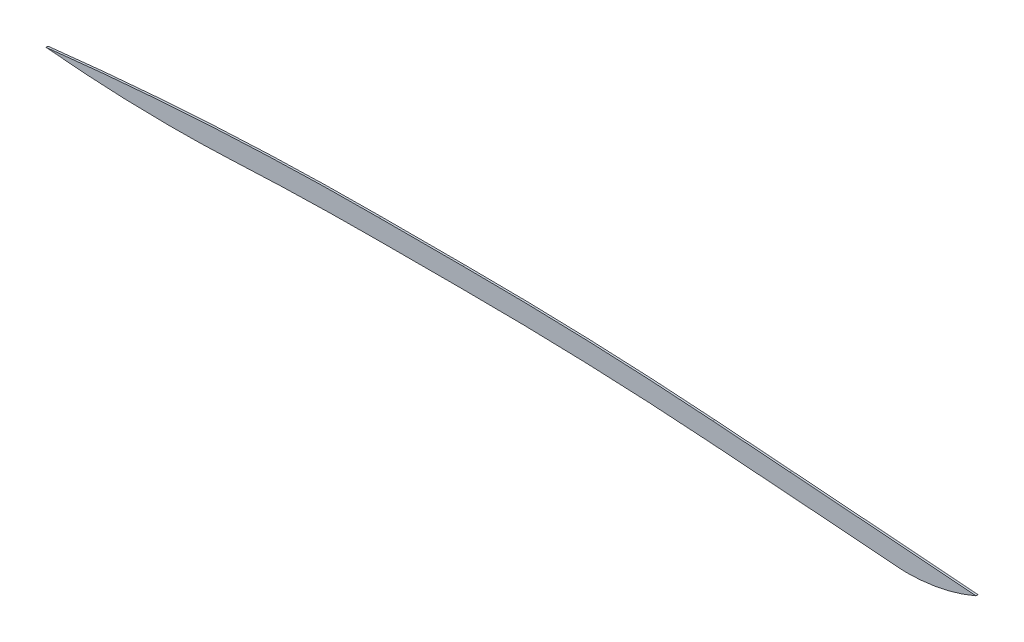
from build123d import *

# Parameters (mm, degrees)
BOSS_EXTRUDE1_DEPTH = 10


with BuildPart() as part:
    # Sketch1 → Boss-Extrude1 (new body)
    with BuildSketch(Plane.XY):
        with BuildLine():
            Line((1659.566121622, -5.412251186), (2076.89523305, -5.412251186))
            ThreePointArc((2076.89523305, -5.412251186), (2375.641258252, -8.033022811), (2674.295326878, -15.894530989))
            ThreePointArc((2674.295326878, -15.894530989), (2807.667775437, -21.099833603), (2940.995326878, -27.350372482))
            ThreePointArc((2940.995326878, -27.350372482), (3129.39992894, -37.970043076), (3317.675281863, -50.676850811))
            ThreePointArc((3317.675281863, -50.676850811), (3509.448873108, -64.791979183), (3701.21228195, -79.044774608))
            ThreePointArc((3701.21228195, -79.044774608), (3992.518537325, -100.909528904), (4283.800774044, -123.091965039))
            add(Edge.make_bspline(
                [(4636.8917974, -50.10599755), (4468.425620034, -123.019662218), (4283.800774044, -123.091965039)],
                knots=[0, 0, 0, 1, 1, 1], degree=2))
            ThreePointArc((4636.8917974, -50.10599755), (4172.797945089, -14.310488335), (3708.642612964, 20.678794226))
            ThreePointArc((3708.642612964, 20.678794226), (3516.807267992, 34.936923471), (3324.961736788, 49.057333773))
            ThreePointArc((3324.961736788, 49.057333773), (3135.580740786, 61.838761971), (2946.069736633, 72.520796359))
            ThreePointArc((2946.069736633, 72.520796359), (2811.95922193, 78.808041397), (2677.803546453, 84.043912041))
            ThreePointArc((2677.803546453, 84.043912041), (2377.395638046, 91.951586762), (2076.89523305, 94.587748814))
            Line((2076.89523305, 94.587748814), (1659.566121622, 94.587748814))
            ThreePointArc((1659.566121622, 94.587748814), (1174.01952466, 86.51504314), (689.009647082, 62.305849623))
            ThreePointArc((689.009647082, 62.305849623), (487.518786709, 47.486939475), (286.252176699, 29.882434183))
            ThreePointArc((286.252176699, 29.882434183), (143.052483543, 15.646298075), (0, 0))
            add(Edge.make_bspline(
                [(0, 0), (462.61176079, -45.50450094), (927.370608086, -23.902888447)],
                knots=[0, 0, 0, 1, 1, 1], degree=2))
            ThreePointArc((927.370608086, -23.902888447), (1293.351644263, -10.035647291), (1659.566121622, -5.412251186))
        make_face()
    extrude(amount=BOSS_EXTRUDE1_DEPTH)


solid = part.part
